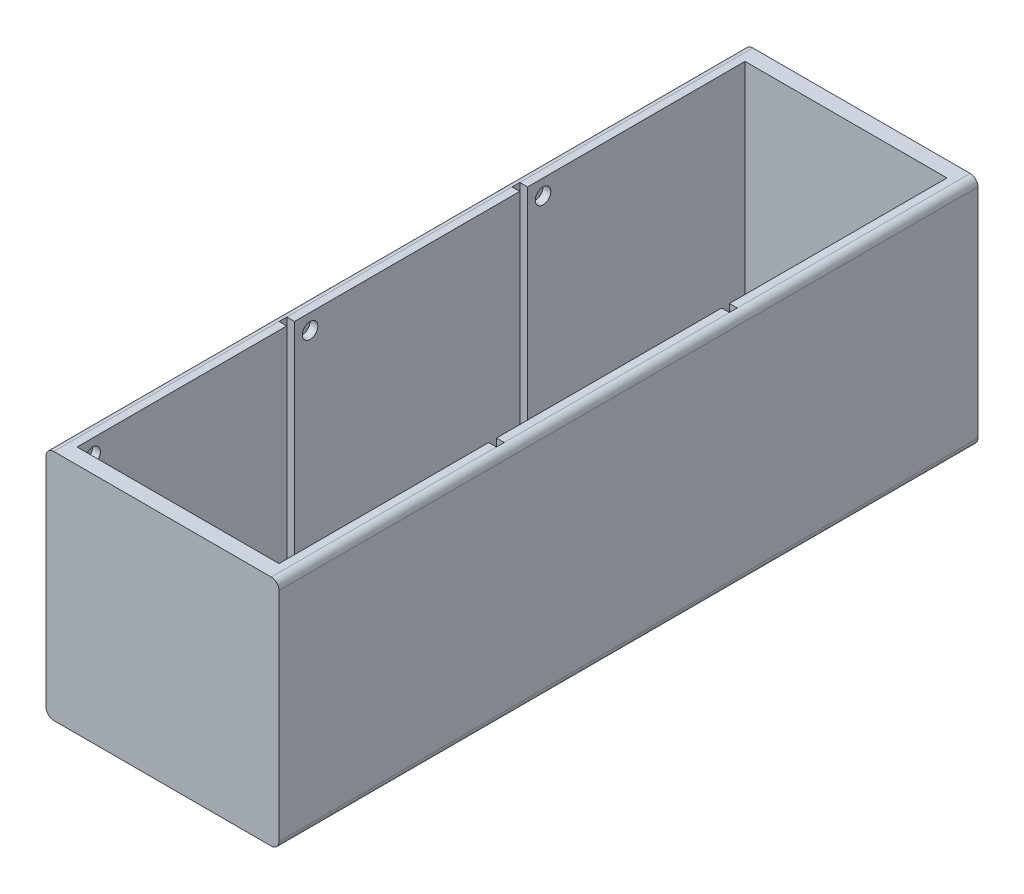
from build123d import *

# Parameters (mm, degrees)
SKETCH1_W           = 300
SKETCH1_H           = 300
BOSS_EXTRUDE1_DEPTH = 900
SHELL1_T            = -20
SKETCH2_W           = 280
SKETCH2_H           = 10
CUT_EXTRUDE1_DEPTH  = 290
SKETCH3_R           = 10
CUT_EXTRUDE2_DEPTH  = 10
FILLET1_START       = -1
FILLET1_DEPTH       = 902


with BuildPart() as part:
    # Sketch1 → Boss-Extrude1 (new body)
    with BuildSketch(Plane.XY):
        with Locations((-187.974683544, -55.696202532)):
            Rectangle(SKETCH1_W, SKETCH1_H)
    extrude(amount=BOSS_EXTRUDE1_DEPTH)

    # Shell1
    shell1_openings = [part.faces().sort_by_distance(p)[0] for p in [
        (-187.974683544, 94.303797468, 450),
    ]]
    offset(amount=SHELL1_T, openings=shell1_openings, kind=Kind.INTERSECTION)

    # Sketch2 → Cut-Extrude1 (cut)
    with BuildSketch(Plane(origin=(0, 94.303797468, 0), x_dir=(1, 0, 0), z_dir=(0, 1, 0))):
        with Locations((-187.974683544, -305)):
            Rectangle(SKETCH2_W, SKETCH2_H)
        with Locations((-187.974683544, -605)):
            Rectangle(SKETCH2_W, SKETCH2_H)
    extrude(amount=-CUT_EXTRUDE1_DEPTH, mode=Mode.SUBTRACT)

    # Sketch3 → Cut-Extrude2 (cut)
    with BuildSketch(Plane(origin=(-317.974683544, 0, 0), x_dir=(0, 0, -1), z_dir=(1, 0, 0))):
        with Locations(Location((-580, 74.303797468, 0), (0, 0, 90))):
            Circle(SKETCH3_R)
        with Locations(Location((-280, 74.303797468, 0), (0, 0, 90))):
            Circle(SKETCH3_R)
        with Locations(Location((-860, 74.303797468, 0), (0, 0, 90))):
            Circle(SKETCH3_R)
    extrude(amount=-CUT_EXTRUDE2_DEPTH, mode=Mode.SUBTRACT)

    # Fillet1: read off the stored shape, not the designer's step
    # Fillet1 outline → Fillet1 (cut)
    with BuildSketch(Plane.XY.offset(FILLET1_START)):
        with BuildLine():
            Line((-37.974683544, 94.303797468), (-47.974683544, 94.303797468))
            ThreePointArc((-47.974683544, 94.303797468), (-40.903615732, 91.37486528), (-37.974683544, 84.303797468))
            Line((-37.974683544, 84.303797468), (-37.974683544, 94.303797468))
        make_face()
        with BuildLine():
            Line((-37.974683544, -205.696202532), (-37.974683544, -195.696202532))
            ThreePointArc((-37.974683544, -195.696202532), (-40.903615732, -202.767270344), (-47.974683544, -205.696202532))
            Line((-47.974683544, -205.696202532), (-37.974683544, -205.696202532))
        make_face()
        with BuildLine():
            ThreePointArc((-337.974683544, 84.303797468), (-335.045751356, 91.37486528), (-327.974683544, 94.303797468))
            Line((-327.974683544, 94.303797468), (-337.974683544, 94.303797468))
            Line((-337.974683544, 94.303797468), (-337.974683544, 84.303797468))
        make_face()
        with BuildLine():
            Line((-337.974683544, -205.696202532), (-327.974683544, -205.696202532))
            ThreePointArc((-327.974683544, -205.696202532), (-335.045751356, -202.767270344), (-337.974683544, -195.696202532))
            Line((-337.974683544, -195.696202532), (-337.974683544, -205.696202532))
        make_face()
    extrude(amount=FILLET1_DEPTH, mode=Mode.SUBTRACT)


solid = part.part
